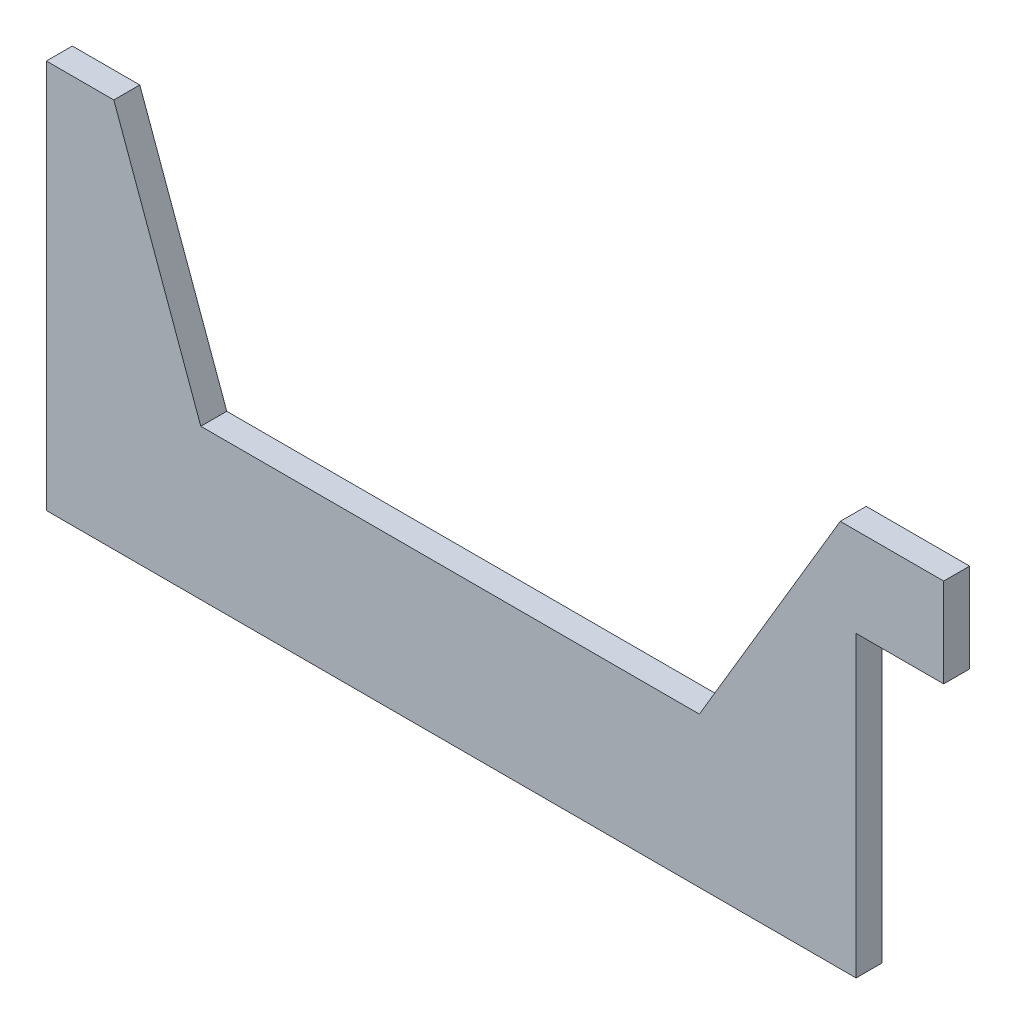
from build123d import *

# Parameters (mm, degrees)
BOSS_EXTRUDE1_DEPTH = 2


with BuildPart() as part:
    # Sketch1 → Boss-Extrude1 (new, symmetric)
    with BuildSketch(Plane.XY):
        Polygon((-60.75, -30), (-60.75, 30), (-50.352877454, 30), (-36.945370579, -6.855179418), (39.897088693, -6.855179418), (61.606830496, 29.73214036), (77.549740604, 29.73214036), (77.549740604, 16), (64.049740604, 16), (64.049740604, -30), align=None)
    extrude(amount=BOSS_EXTRUDE1_DEPTH, both=True)


solid = part.part
